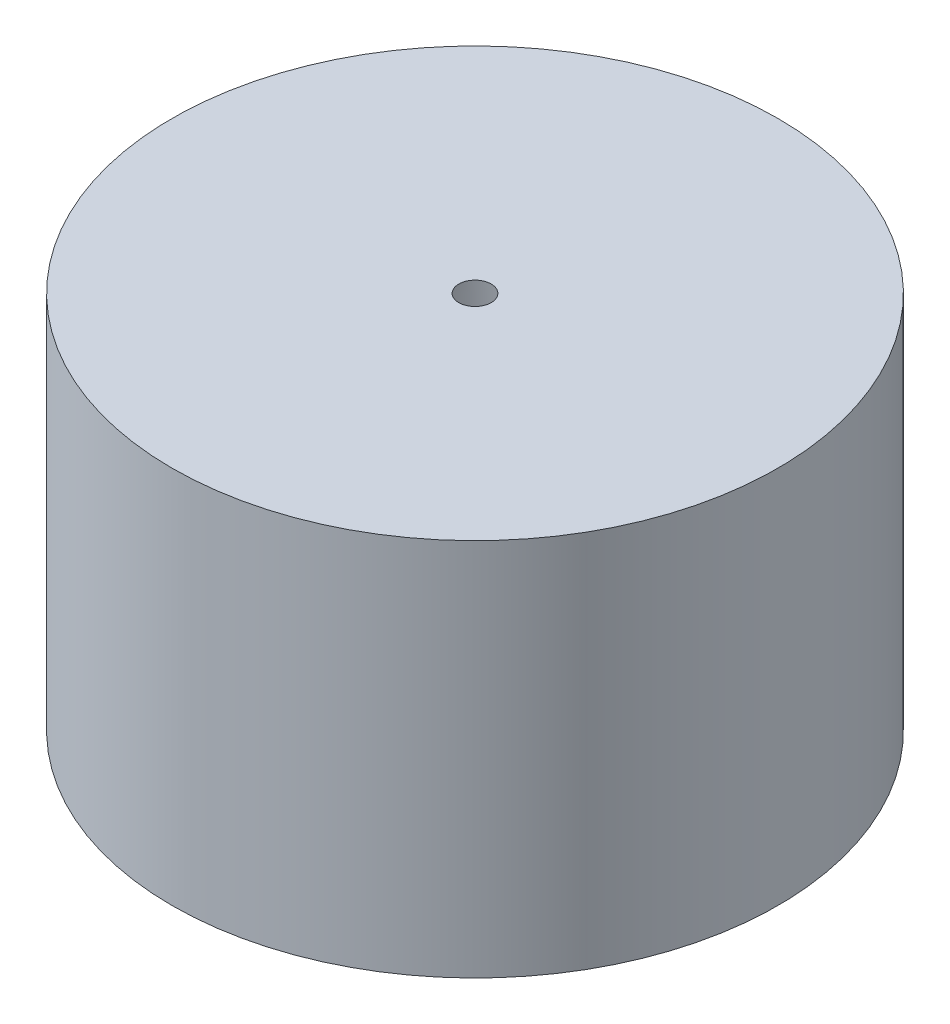
from build123d import *


with BuildPart() as part:
    # Эскиз1 → Повернуть1 (revolve)
    with BuildSketch(Plane.XY):
        Polygon((17, 27), (17, 25.8), (30, 25.8), (30, 23.3), (28.4, 23.3), (28.4, 15.3), (37.427682956, 15.3), (37.427682956, 62.097891733), (2, 62.097891733), (8, 58.633790118), (8.347561618, 52.001919373), (12, 47.001919373), (12.786217279, 32), align=None)
    revolve(axis=Axis((0, 0, 0), (0, 1, 0)))


solid = part.part
